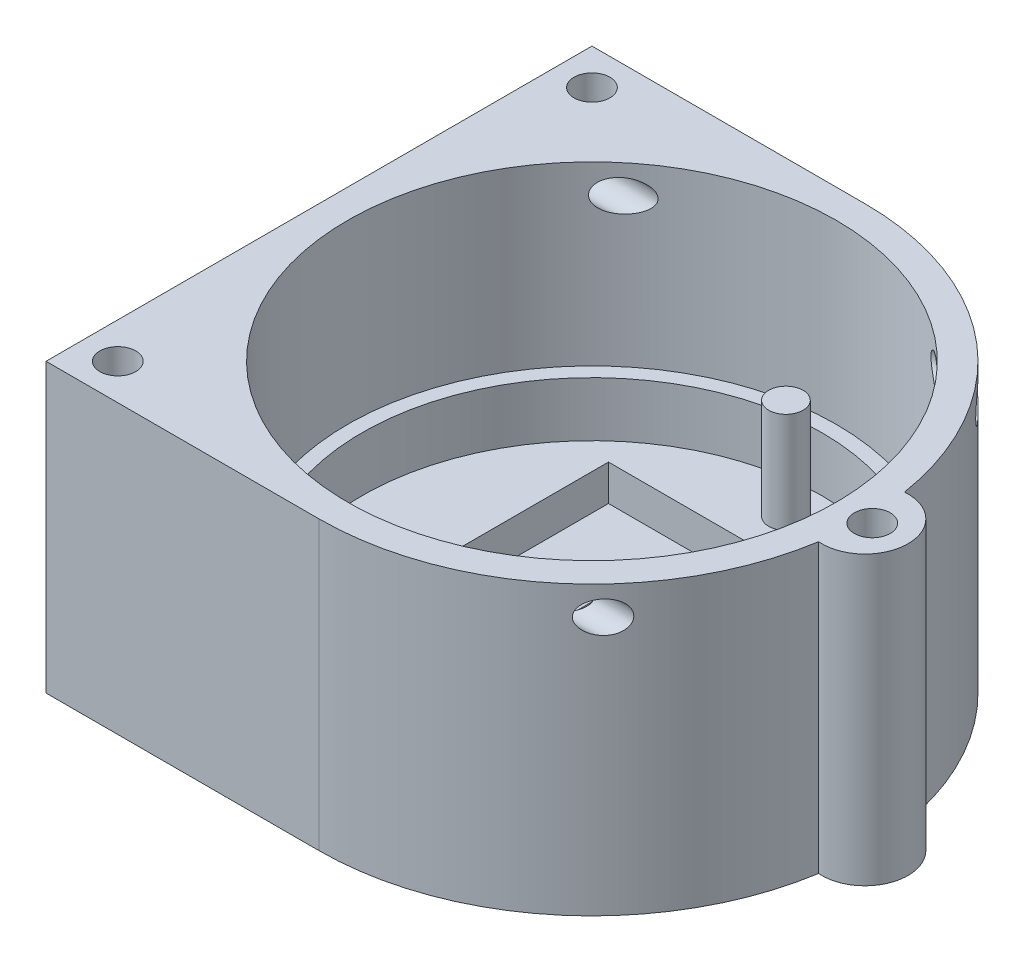
from build123d import *

# Parameters (mm, degrees)
MAIN_BODY_DEPTH                      = 20
CUT_START                            = -7.7
SKETCH5_R                            = 17
CUT_FOR_HEADERS_DEPTH                = 28.584557529
SKETCH8_R                            = 16
CUT_FOR_PCB_DEPTH                    = 3.8
SKETCH10_W                           = 18.9
SKETCH10_H                           = 21.2
CUT_FOR_LENS_DEPTH                   = 2.5
CUT_FOR_PUPIL_REACH                  = 36.51
SKETCH11_W                           = 8.2
SKETCH11_H                           = 10.2
CUTS_FOR_BODY_SCREW_HOLES_DEPTH      = 36.284557529
CUTS_FOR_BODY_SCREW_HOLES_DEPTH_BACK = 36.284557529
SKETCH13_R                           = 1.1
SKETCH14_R                           = 1.25
CUT_FOR_TOP_SCREW_HOLES_DEPTH        = 7
SKETCH9_2_R                          = 1.2
EXTRUSION_FOR_HOLDING_PCB_DEPTH      = 7


with BuildPart() as part:
    # Sketch3 → Main Body (new body)
    with BuildSketch(Plane(origin=(0, 0, 0), x_dir=(1, 0, 0), z_dir=(0, 1, 0))):
        with BuildLine():
            Line((0, 19), (-19, 19))
            Line((-19, 19), (-19, -19))
            Line((-19, -19), (0, -19))
            ThreePointArc((0, -19), (12.332435064, -14.453755408), (18.763157895, -2.990636357))
            ThreePointArc((18.763157895, -2.990636357), (22, 0), (18.763157895, 2.990636357))
            ThreePointArc((18.763157895, 2.990636357), (12.332435064, 14.453755408), (0, 19))
        make_face()
    extrude(amount=-MAIN_BODY_DEPTH)

    # Sketch5 → Cut for Headers (cut, through all)
    with BuildSketch(Plane.XZ.offset(20).offset(CUT_START)):
        Circle(SKETCH5_R)
    extrude(amount=-CUT_FOR_HEADERS_DEPTH, mode=Mode.SUBTRACT)

    # Sketch8 → Cut for PCB (cut)
    with BuildSketch(Plane(origin=(0, -12.3, 0), x_dir=(1, 0, 0), z_dir=(0, 1, 0))):
        Circle(SKETCH8_R)
    extrude(amount=-CUT_FOR_PCB_DEPTH, mode=Mode.SUBTRACT)

    # Sketch10 → Cut for Lens (cut)
    with BuildSketch(Plane(origin=(0, -16.1, 0), x_dir=(1, 0, 0), z_dir=(0, 1, 0))):
        Rectangle(SKETCH10_W, SKETCH10_H)
    extrude(amount=-CUT_FOR_LENS_DEPTH, mode=Mode.SUBTRACT)

    # Sketch11 → Cut for Pupil (cut, up to next)
    with BuildSketch(Plane(origin=(0, -18.6, 0), x_dir=(1, 0, 0), z_dir=(0, 1, 0)), mode=Mode.PRIVATE) as cut_for_pupil_sk1:
        Rectangle(SKETCH11_W, SKETCH11_H)
    cut_for_pupil_tool1 = extrude(cut_for_pupil_sk1.sketch, amount=-CUT_FOR_PUPIL_REACH, mode=Mode.PRIVATE) & part.part
    add(cut_for_pupil_tool1.solids().sort_by_distance((0, -18.6, 0))[0], mode=Mode.SUBTRACT)

    # Sketch13 → Cuts for Body Screw Holes (cut, two sides: drawn at the far end of the back side and taken through both)
    with BuildSketch(Plane(origin=(0, 0, 0), x_dir=(0, 0, -1), z_dir=(1, 0, 0)).offset(-CUTS_FOR_BODY_SCREW_HOLES_DEPTH_BACK)):
        with Locations((13, -2)):
            Circle(SKETCH13_R)
        with Locations((-13, -2)):
            Circle(SKETCH13_R)
    extrude(amount=CUTS_FOR_BODY_SCREW_HOLES_DEPTH + CUTS_FOR_BODY_SCREW_HOLES_DEPTH_BACK, mode=Mode.SUBTRACT)

    # Sketch14 → Cut for Top Screw Holes (cut)
    with BuildSketch(Plane(origin=(0, 0, 0), x_dir=(1, 0, 0), z_dir=(0, 1, 0))):
        with Locations((19.513157895, 0)):
            Circle(SKETCH14_R)
        with Locations((-16.5, 16.5)):
            Circle(SKETCH14_R)
        with Locations((-16.5, -16.5)):
            Circle(SKETCH14_R)
    extrude(amount=-CUT_FOR_TOP_SCREW_HOLES_DEPTH, mode=Mode.SUBTRACT)

    # Sketch9<2> → Extrusion for Holding PCB (add)
    with BuildSketch(Plane(origin=(0, -16.1, 0), x_dir=(1, 0, 0), z_dir=(0, 1, 0))):
        with Locations((0, 13.5)):
            Circle(SKETCH9_2_R)
        with Locations((0, -13.5)):
            Circle(SKETCH9_2_R)
    extrude(amount=EXTRUSION_FOR_HOLDING_PCB_DEPTH)


solid = part.part
